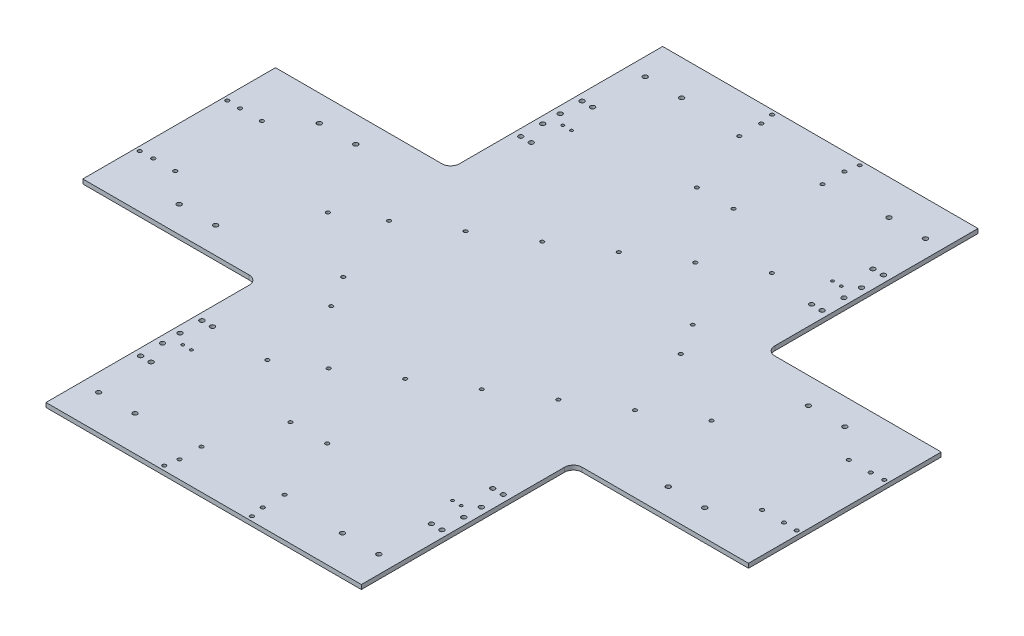
from build123d import *

# Parameters (mm, degrees)
BOSS_EXTRUDE1_DEPTH = 5
SKETCH2_R           = 2.125
CUT_EXTRUDE1_DEPTH  = 3
SKETCH4_R           = 2.6
SKETCH4_R_2         = 1.6
CUT_EXTRUDE3_DEPTH  = 10
SKETCH5_R           = 2.1
CUT_EXTRUDE4_DEPTH  = 10
FILLET1_R           = 10
SKETCH6_R           = 2.6
CUT_EXTRUDE5_DEPTH  = 10
SKETCH7_R           = 2.1
CUT_EXTRUDE6_DEPTH  = 10
SKETCH9_R           = 2.1
CUT_EXTRUDE7_DEPTH  = 10


with BuildPart() as part:
    # Sketch1 → Boss-Extrude1 (new body)
    with BuildSketch(Plane(origin=(0, 0, 0), x_dir=(1, 0, 0), z_dir=(0, 1, 0))):
        Polygon((180, 352), (-180, 352), (-180, 110), (-380, 110), (-380, -110), (-180, -110), (-180, -352), (180, -352), (180, -110), (380, -110), (380, 110), (180, 110), align=None)
    extrude(amount=BOSS_EXTRUDE1_DEPTH)

    # Sketch2 → Cut-Extrude1 (cut)
    with BuildSketch(Plane(origin=(0, 5, 0), x_dir=(1, 0, 0), z_dir=(0, 1, 0))):
        with Locations((360, 49.5)):
            Circle(SKETCH2_R)
        with Locations((335, 49.5)):
            Circle(SKETCH2_R)
        with Locations((335, -49.5)):
            Circle(SKETCH2_R)
        with Locations((360, -49.5)):
            Circle(SKETCH2_R)
        with Locations((-360, -49.5)):
            Circle(SKETCH2_R)
        with Locations((-335, -49.5)):
            Circle(SKETCH2_R)
        with Locations((-335, 49.5)):
            Circle(SKETCH2_R)
        with Locations((-360, 49.5)):
            Circle(SKETCH2_R)
        with Locations((47.5, 332)):
            Circle(SKETCH2_R)
        with Locations((47.5, 307)):
            Circle(SKETCH2_R)
        with Locations((-47.5, 307)):
            Circle(SKETCH2_R)
        with Locations((-47.5, 332)):
            Circle(SKETCH2_R)
        with Locations((-47.5, -332)):
            Circle(SKETCH2_R)
        with Locations((-47.5, -307)):
            Circle(SKETCH2_R)
        with Locations((47.5, -307)):
            Circle(SKETCH2_R)
        with Locations((47.5, -332)):
            Circle(SKETCH2_R)
    extrude(amount=-CUT_EXTRUDE1_DEPTH, mode=Mode.SUBTRACT)

    # Sketch4 → Cut-Extrude3 (cut)
    with BuildSketch(Plane(origin=(0, 5, 0), x_dir=(1, 0, 0), z_dir=(0, 1, 0))):
        with Locations((-172, 182)):
            Circle(SKETCH4_R)
        with Locations((-160, 182)):
            Circle(SKETCH4_R)
        with Locations((-172, 207)):
            Circle(SKETCH4_R)
        with Locations((-172, 227)):
            Circle(SKETCH4_R)
        with Locations((-172, 252)):
            Circle(SKETCH4_R)
        with Locations((-160, 252)):
            Circle(SKETCH4_R)
        with Locations((160, 252)):
            Circle(SKETCH4_R)
        with Locations((172, 252)):
            Circle(SKETCH4_R)
        with Locations((172, 227)):
            Circle(SKETCH4_R)
        with Locations((172, 207)):
            Circle(SKETCH4_R)
        with Locations((160, 182)):
            Circle(SKETCH4_R)
        with Locations((172, 182)):
            Circle(SKETCH4_R)
        with Locations((172, -182)):
            Circle(SKETCH4_R)
        with Locations((160, -182)):
            Circle(SKETCH4_R)
        with Locations((172, -207)):
            Circle(SKETCH4_R)
        with Locations((172, -227)):
            Circle(SKETCH4_R)
        with Locations((172, -252)):
            Circle(SKETCH4_R)
        with Locations((160, -252)):
            Circle(SKETCH4_R)
        with Locations((-160, -252)):
            Circle(SKETCH4_R)
        with Locations((-172, -252)):
            Circle(SKETCH4_R)
        with Locations((-172, -227)):
            Circle(SKETCH4_R)
        with Locations((-172, -207)):
            Circle(SKETCH4_R)
        with Locations((-160, -182)):
            Circle(SKETCH4_R)
        with Locations((-172, -182)):
            Circle(SKETCH4_R)
        with Locations((159, -217)):
            Circle(SKETCH4_R_2)
        with Locations((-159, -217)):
            Circle(SKETCH4_R_2)
        with Locations((159, 217)):
            Circle(SKETCH4_R_2)
        with Locations((-159, 217)):
            Circle(SKETCH4_R_2)
        with Locations((149, -217)):
            Circle(SKETCH4_R_2)
        with Locations((-149, -217)):
            Circle(SKETCH4_R_2)
        with Locations((149, 217)):
            Circle(SKETCH4_R_2)
        with Locations((-149, 217)):
            Circle(SKETCH4_R_2)
    extrude(amount=-CUT_EXTRUDE3_DEPTH, mode=Mode.SUBTRACT)

    # Sketch5 → Cut-Extrude4 (cut)
    with BuildSketch(Plane(origin=(0, 5, 0), x_dir=(1, 0, 0), z_dir=(0, 1, 0))):
        with Locations((-50, 347)):
            Circle(SKETCH5_R)
        with Locations((50, 347)):
            Circle(SKETCH5_R)
        with Locations((50, -347)):
            Circle(SKETCH5_R)
        with Locations((-50, -347)):
            Circle(SKETCH5_R)
        with Locations((-375, 50)):
            Circle(SKETCH5_R)
        with Locations((-375, -50)):
            Circle(SKETCH5_R)
        with Locations((375, -50)):
            Circle(SKETCH5_R)
        with Locations((375, 50)):
            Circle(SKETCH5_R)
    extrude(amount=-CUT_EXTRUDE4_DEPTH, mode=Mode.SUBTRACT)

    # Fillet1
    fillet1_edges = [part.edges().sort_by_distance(p)[0] for p in [
        (-180, 2.5, -110),
        (-180, 2.5, 110),
        (180, 2.5, 110),
        (180, 2.5, -110),
    ]]
    fillet(fillet1_edges, radius=FILLET1_R)

    # Sketch6 → Cut-Extrude5 (cut)
    with BuildSketch(Plane(origin=(0, 5, 0), x_dir=(1, 0, 0), z_dir=(0, 1, 0))):
        with Locations((-160, 312)):
            Circle(SKETCH6_R)
        with Locations((-118.4, 312)):
            Circle(SKETCH6_R)
        with Locations((118.4, 312)):
            Circle(SKETCH6_R)
        with Locations((160, 312)):
            Circle(SKETCH6_R)
        with Locations((160, -312)):
            Circle(SKETCH6_R)
        with Locations((118.4, -312)):
            Circle(SKETCH6_R)
        with Locations((-118.4, -312)):
            Circle(SKETCH6_R)
        with Locations((-160, -312)):
            Circle(SKETCH6_R)
        with Locations((258.4, 80)):
            Circle(SKETCH6_R)
        with Locations((300, 80)):
            Circle(SKETCH6_R)
        with Locations((300, -80)):
            Circle(SKETCH6_R)
        with Locations((258.4, -80)):
            Circle(SKETCH6_R)
        with Locations((-258.4, -80)):
            Circle(SKETCH6_R)
        with Locations((-300, -80)):
            Circle(SKETCH6_R)
        with Locations((-300, 80)):
            Circle(SKETCH6_R)
        with Locations((-258.4, 80)):
            Circle(SKETCH6_R)
    extrude(amount=-CUT_EXTRUDE5_DEPTH, mode=Mode.SUBTRACT)

    # Sketch7 → Cut-Extrude6 (cut)
    with BuildSketch(Plane(origin=(0, 5, 0), x_dir=(1, 0, 0), z_dir=(0, 1, 0))):
        with Locations((-55.682048102, 90.197059371)):
            Circle(SKETCH7_R)
        with Locations((-1.648904044, 123.553757998)):
            Circle(SKETCH7_R)
        with Locations((52.384240013, 156.910456625)):
            Circle(SKETCH7_R)
        with Locations((106.41738407, 190.267155252)):
            Circle(SKETCH7_R)
        with Locations((-109.715192159, 56.840360744)):
            Circle(SKETCH7_R)
        with Locations((-163.748336216, 23.483662117)):
            Circle(SKETCH7_R)
        with Locations((-206.974851462, -3.201696784)):
            Circle(SKETCH7_R)
        with Locations((-95.610755259, -183.595815527)):
            Circle(SKETCH7_R)
        with Locations((-52.384240013, -156.910456625)):
            Circle(SKETCH7_R)
        with Locations((1.648904044, -123.553757998)):
            Circle(SKETCH7_R)
        with Locations((217.781480273, 9.87303651)):
            Circle(SKETCH7_R)
        with Locations((163.748336216, -23.483662117)):
            Circle(SKETCH7_R)
        with Locations((109.715192159, -56.840360744)):
            Circle(SKETCH7_R)
        with Locations((55.682048102, -90.197059371)):
            Circle(SKETCH7_R)
    extrude(amount=-CUT_EXTRUDE6_DEPTH, mode=Mode.SUBTRACT)

    # Sketch9 → Cut-Extrude7 (cut)
    with BuildSketch(Plane(origin=(0, 5, 0), x_dir=(1, 0, 0), z_dir=(0, 1, 0))):
        with Locations((-134.396185529, -58.288539604)):
            Circle(SKETCH9_R)
        with Locations((-112.333487225, -94.026997091)):
            Circle(SKETCH9_R)
        with Locations((112.333487225, 94.026997091)):
            Circle(SKETCH9_R)
        with Locations((134.396185529, 58.288539604)):
            Circle(SKETCH9_R)
        with Locations((21, 232)):
            Circle(SKETCH9_R)
        with Locations((-21, 232)):
            Circle(SKETCH9_R)
        with Locations((-21, -232)):
            Circle(SKETCH9_R)
        with Locations((21, -232)):
            Circle(SKETCH9_R)
    extrude(amount=-CUT_EXTRUDE7_DEPTH, mode=Mode.SUBTRACT)


solid = part.part
